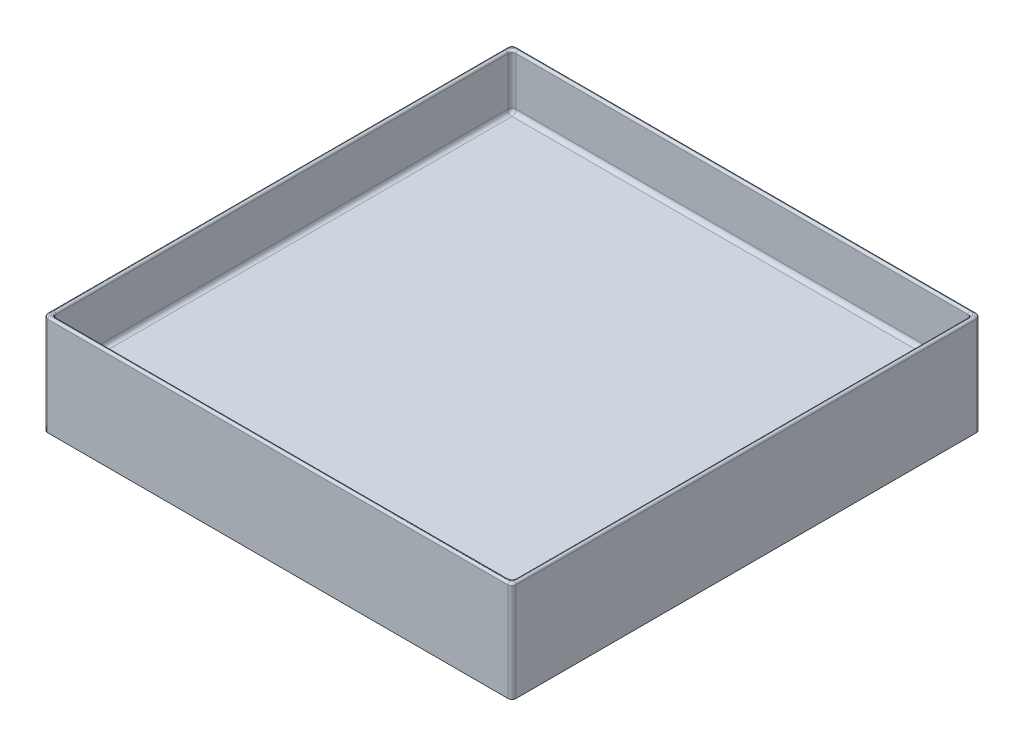
from build123d import *

# Parameters (mm, degrees)
SKETCH1_W           = 560
SKETCH1_H           = 560
BOSS_EXTRUDE1_DEPTH = 5
SKETCH2_W           = 560
SKETCH2_H           = 560
SKETCH2_W_2         = 550
SKETCH2_H_2         = 550
BOSS_EXTRUDE2_DEPTH = 65
BOSS_EXTRUDE3_START = -5
SKETCH2_2_W         = 560
SKETCH2_2_H         = 560
SKETCH2_2_W_2       = 550
SKETCH2_2_H_2       = 550
BOSS_EXTRUDE3_DEPTH = 50
SKETCH7_W           = 100
SKETCH7_H           = 200
BOSS_EXTRUDE5_DEPTH = 5
SKETCH8_W           = 100
SKETCH8_H           = 35
BOSS_EXTRUDE6_DEPTH = 5
SKETCH9_R           = 3
CUT_EXTRUDE1_DEPTH  = 5
FILLET1_R           = 5
FILLET2_R           = 2.5
FILLET3_R           = 5


# Some blends are built 0.0001 mm under size
with BuildPart() as part:
    # Sketch1 → Boss-Extrude1 (new body)
    with BuildSketch(Plane(origin=(0, 0, 0), x_dir=(1, 0, 0), z_dir=(0, 1, 0))):
        Rectangle(SKETCH1_W, SKETCH1_H)
    extrude(amount=BOSS_EXTRUDE1_DEPTH)

    # Sketch2 → Boss-Extrude2 (add)
    with BuildSketch(Plane(origin=(0, 5, 0), x_dir=(1, 0, 0), z_dir=(0, 1, 0))):
        Rectangle(SKETCH2_W, SKETCH2_H)
        Rectangle(SKETCH2_W_2, SKETCH2_H_2, mode=Mode.SUBTRACT)
    extrude(amount=BOSS_EXTRUDE2_DEPTH)

    # Sketch2<2> → Boss-Extrude3 (add)
    with BuildSketch(Plane(origin=(0, 5, 0), x_dir=(1, 0, 0), z_dir=(0, 1, 0)).offset(BOSS_EXTRUDE3_START)):
        Rectangle(SKETCH2_2_W, SKETCH2_2_H)
        Rectangle(SKETCH2_2_W_2, SKETCH2_2_H_2, mode=Mode.SUBTRACT)
    extrude(amount=-BOSS_EXTRUDE3_DEPTH)



with BuildPart() as body_2:
    # Sketch7 → Boss-Extrude5 (new body)
    with BuildSketch(Plane(origin=(0, -30, 0), x_dir=(-1, 0, 0), z_dir=(0, -1, 0))):
        Rectangle(SKETCH7_W, SKETCH7_H)
    extrude(amount=BOSS_EXTRUDE5_DEPTH)


with BuildPart() as part_1:
    add(part.part)

    add(body_2.part)  # Boss-Extrude6 merges body 2
    # Sketch8 → Boss-Extrude6 (add)
    with BuildSketch(Plane(origin=(0, 0, -100), x_dir=(-1, 0, 0), z_dir=(0, 0, -1))):
        with Locations((0, -17.5)):
            Rectangle(SKETCH8_W, SKETCH8_H)
    boss_extrude6 = extrude(amount=BOSS_EXTRUDE6_DEPTH)

    # Mirror1: Boss-Extrude6 across plane
    add(boss_extrude6.mirror(Plane(origin=(0, 0, 0), x_dir=(1, 0, 0), z_dir=(0, 0, -1))))

    # Sketch9 → Cut-Extrude1 (cut)
    with BuildSketch(Plane.XZ.offset(35)):
        with Locations(Location((7.5, 52.990381057, 0), (0, 0, 270))):
            Circle(SKETCH9_R)
        with Locations(Location((0, 40, 0), (0, 0, 270))):
            Circle(SKETCH9_R)
        with Locations(Location((-7.5, 52.990381057, 0), (0, 0, 270))):
            Circle(SKETCH9_R)
    extrude(amount=-CUT_EXTRUDE1_DEPTH, mode=Mode.SUBTRACT)

    # Fillet1
    fillet1_edges = [part_1.edges().sort_by_distance(p)[0] for p in [
        (275, 5, 0),
        (0, 5, -275),
        (-275, 5, 0),
        (0, 5, 275),
        (275, 37.5, -275),
        (-275, 37.5, -275),
        (-275, 37.5, 275),
        (275, 37.5, 275),
        (275, 0, 0),
        (275, -25, 275),
        (0, 0, 275),
        (-275, -25, 275),
        (-275, 0, 0),
        (-275, -25, -275),
        (0, 0, -275),
        (275, -25, -275),
        (0, -35, -105),
        (0, 0, -105),
        (0, 0, 105),
        (0, -35, 105),
    ]]
    fillet(fillet1_edges, radius=FILLET1_R)

    # Fillet2
    fillet2_edges = [part_1.edges().sort_by_distance(p)[0] for p in [
        (275, 70, 0),
        (0, 70, -275),
        (0, 70, 275),
        (-275, 70, 0),
        (273.535533906, 70, -273.535533906),
        (273.535533906, 70, 273.535533906),
        (-273.535533906, 70, 273.535533906),
        (-273.535533906, 70, -273.535533906),
        (0, 70, 280),
        (280, 70, 0),
        (0, 70, -280),
        (-280, 70, 0),
    ]]
    fillet(fillet2_edges, radius=FILLET2_R - 0.0001)  # a hair under: the kernel refuses the full size

    # Fillet3
    # the kernel refuses this fillet: 5 mm, written as the material it takes off along each edge
    with BuildSketch(Plane(origin=(275, 70, 275), x_dir=(0, 0, 1), z_dir=(-1, 0, 0))) as fillet3_piece_1:
        with BuildLine():
            CenterArc((2.5001, -2.4999), 2.4999, 0, 90)
            Line((5, -2.4999), (5, 0))
            Line((5, 0), (2.5001, 0))
        make_face()
    revolve(axis=Axis((275, 70, 275), (0, 1, 0)), revolution_arc=90, mode=Mode.SUBTRACT)
    with BuildSketch(Plane(origin=(-275, 70, 275), x_dir=(-1, 0, 0), z_dir=(0, 0, -1))) as fillet3_piece_2:
        with BuildLine():
            CenterArc((2.5001, -2.4999), 2.4999, 0, 90)
            Line((5, -2.4999), (5, 0))
            Line((5, 0), (2.5001, 0))
        make_face()
    revolve(axis=Axis((-275, 70, 275), (0, 1, 0)), revolution_arc=90, mode=Mode.SUBTRACT)
    with BuildSketch(Plane(origin=(-275, 70, -275), x_dir=(0, 0, -1), z_dir=(1, 0, 0))) as fillet3_piece_3:
        with BuildLine():
            CenterArc((2.5001, -2.4999), 2.4999, 0, 90)
            Line((5, -2.4999), (5, 0))
            Line((5, 0), (2.5001, 0))
        make_face()
    revolve(axis=Axis((-275, 70, -275), (0, 1, 0)), revolution_arc=90, mode=Mode.SUBTRACT)
    with BuildSketch(Plane(origin=(275, 70, -275), x_dir=(1, 0, 0), z_dir=(0, 0, 1))) as fillet3_piece_4:
        with BuildLine():
            CenterArc((2.5001, -2.4999), 2.4999, 0, 90)
            Line((5, -2.4999), (5, 0))
            Line((5, 0), (2.5001, 0))
        make_face()
    revolve(axis=Axis((275, 70, -275), (0, 1, 0)), revolution_arc=90, mode=Mode.SUBTRACT)
    with BuildSketch(Plane(origin=(-280, -62.5, -280), x_dir=(0, 0, 1), z_dir=(0, 1, 0)), Plane(origin=(-280, -62.5, 280), x_dir=(1, 0, 0), z_dir=(0, 1, 0)), Plane(origin=(280, 70, -280), x_dir=(0, 0, 1), z_dir=(0, -1, 0)), Plane(origin=(280, 70, 280), x_dir=(-1, 0, 0), z_dir=(0, -1, 0))) as fillet3_piece_5:
        with BuildLine():
            CenterArc((FILLET3_R, FILLET3_R), FILLET3_R, 180, 90)
            Line((0, FILLET3_R), (0, 0))
            Line((0, 0), (FILLET3_R, 0))
        make_face()
    extrude(amount=132.5, mode=Mode.SUBTRACT)


solid = part_1.part
